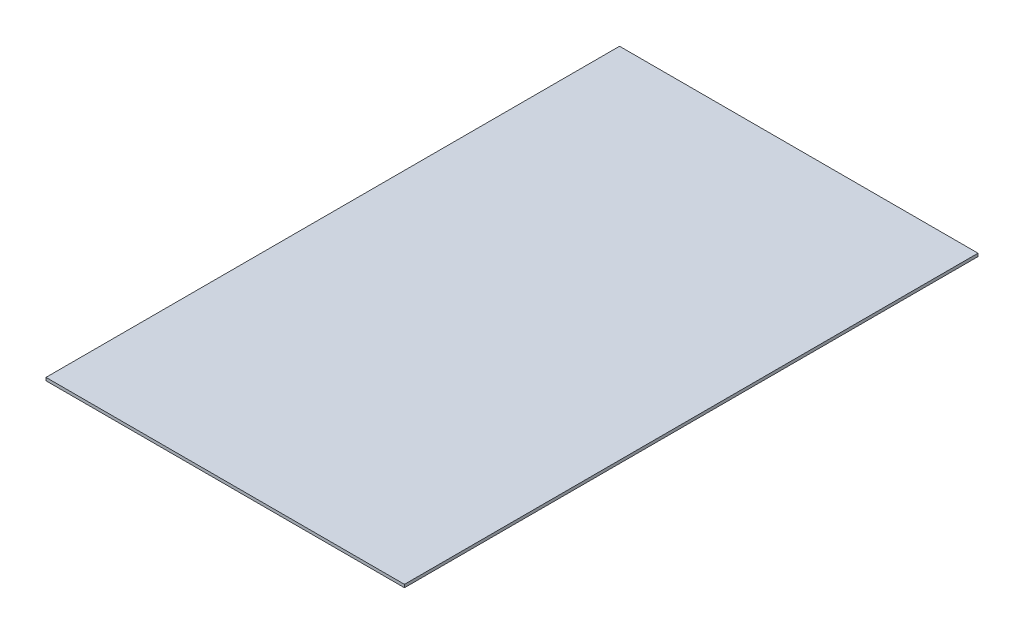
from build123d import *

# Parameters (mm, degrees)
SKETCH1_W           = 381
SKETCH1_H           = 609.6
BOSS_EXTRUDE1_DEPTH = 3.175


with BuildPart() as part:
    # Sketch1 → Boss-Extrude1 (new body)
    with BuildSketch(Plane(origin=(0, 0, 0), x_dir=(1, 0, 0), z_dir=(0, 1, 0))):
        Rectangle(SKETCH1_W, SKETCH1_H)
    extrude(amount=BOSS_EXTRUDE1_DEPTH)


solid = part.part
